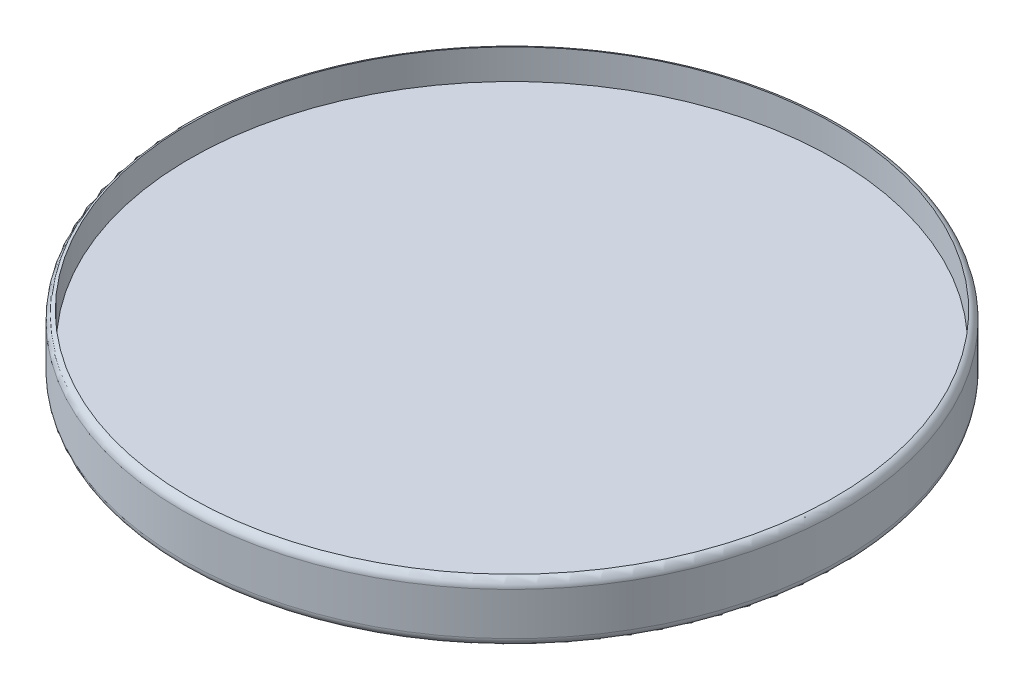
from build123d import *

# Parameters (mm, degrees)
SKETCH1_R           = 46.5455
SKETCH1_R_2         = 2.60858
BOSS_EXTRUDE1_DEPTH = 3.1242
SKETCH1_5_R         = 47.498
SKETCH1_5_R_2       = 46.5455
BOSS_EXTRUDE2_DEPTH = 8.636
FILLET1_R           = 1.27
FILLET2_R           = 1.27
SKETCH2_R           = 46.4312
BOSS_EXTRUDE3_DEPTH = 0.508
SKETCH3_R           = 46.4312
BOSS_EXTRUDE4_DEPTH = 0.762


with BuildPart() as part:
    # Sketch1 → Boss-Extrude1 (new body)
    # profile 1 of 3: a face of its own
    with BuildSketch(Plane(origin=(0, 0, 0), x_dir=(1, 0, 0), z_dir=(0, 1, 0))):
        with Locations(Location((0, 0, 0), (0, 0, 270))):
            Circle(SKETCH1_R)
        Circle(SKETCH1_R_2, mode=Mode.SUBTRACT)
    # profile 2 of 3: a face of its own
    with BuildSketch(Plane(origin=(0, 0, 0), x_dir=(1, 0, 0), z_dir=(0, 1, 0))):
        with BuildLine():
            ThreePointArc((2.60858, 0), (2.193727268, 1.411470966), (1.081120394, 2.37399838))
            Line((1.081120394, 2.37399838), (2.175329976, -1.439662846))
            ThreePointArc((2.175329976, -1.439662846), (2.497920324, -0.751720475), (2.60858, 0))
        make_face()
    # profile 3 of 3: a face of its own
    with BuildSketch(Plane(origin=(0, 0, 0), x_dir=(1, 0, 0), z_dir=(0, 1, 0))):
        with BuildLine():
            Line((-1.081120394, -2.37399838), (-2.175329976, 1.439662846))
            ThreePointArc((-2.175329976, 1.439662846), (-2.507413058, -0.719422946), (-1.081120394, -2.37399838))
        make_face()
    extrude(amount=BOSS_EXTRUDE1_DEPTH)

    # Sketch1<5> → Boss-Extrude2 (add)
    with BuildSketch(Plane(origin=(0, 0, 0), x_dir=(1, 0, 0), z_dir=(0, 1, 0))):
        with Locations(Location((0, 0, 0), (0, 0, 270))):
            Circle(SKETCH1_5_R)
        with Locations(Location((0, 0, 0), (0, 0, 270))):
            Circle(SKETCH1_5_R_2, mode=Mode.SUBTRACT)
    extrude(amount=BOSS_EXTRUDE2_DEPTH)

    # Fillet1
    fillet1_edges = [part.edges().sort_by_distance(p)[0] for p in [
        (0, 0, -47.498),
    ]]
    fillet(fillet1_edges, radius=FILLET1_R)

    # Fillet2
    # the kernel refuses this fillet: 1.27 mm, written as the material it takes off along each edge
    with BuildSketch(Plane(origin=(0, 8.636, 0), x_dir=(0, 0, 1), z_dir=(-1, 0, 0))) as fillet2_piece_1:
        with BuildLine():
            CenterArc((46.228, -1.229672212), FILLET2_R, 0, 75.522487814)
            Line((46.5455, 0), (46.55185, 0.024593444))
            ThreePointArc((46.55185, 0.024593444), (47.02175, 0.0254), (47.498, 0.0254))
            Line((47.498, 0.0254), (47.5234, 0))
            Line((47.5234, 0), (47.5234, -1.229672212))
            Line((47.5234, -1.229672212), (47.498, -1.229672212))
        make_face()
    revolve(axis=Axis((0, 8.636, 0), (0, 1, 0)), mode=Mode.SUBTRACT)

    # Sketch2 → Boss-Extrude3 (add)
    with BuildSketch(Plane(origin=(0, 3.1242, 0), x_dir=(1, 0, 0), z_dir=(0, 1, 0))):
        with Locations(Location((0, 0, 0), (0, 0, 270))):
            Circle(SKETCH2_R)
        with BuildLine():
            Line((-1.081120394, -2.37399838), (-2.175329976, 1.439662846))
            ThreePointArc((-2.175329976, 1.439662846), (-0.719422946, 2.507413058), (1.081120394, 2.37399838))
            Line((1.081120394, 2.37399838), (2.175329976, -1.439662846))
            ThreePointArc((2.175329976, -1.439662846), (0.719422946, -2.507413058), (-1.081120394, -2.37399838))
        make_face(mode=Mode.SUBTRACT)
    extrude(amount=BOSS_EXTRUDE3_DEPTH)

    # Sketch3 → Boss-Extrude4 (add)
    with BuildSketch(Plane(origin=(0, 3.6322, 0), x_dir=(1, 0, 0), z_dir=(0, 1, 0))):
        with Locations(Location((0, 0, 0), (0, 0, 270))):
            Circle(SKETCH3_R)
    extrude(amount=BOSS_EXTRUDE4_DEPTH)


solid = part.part
